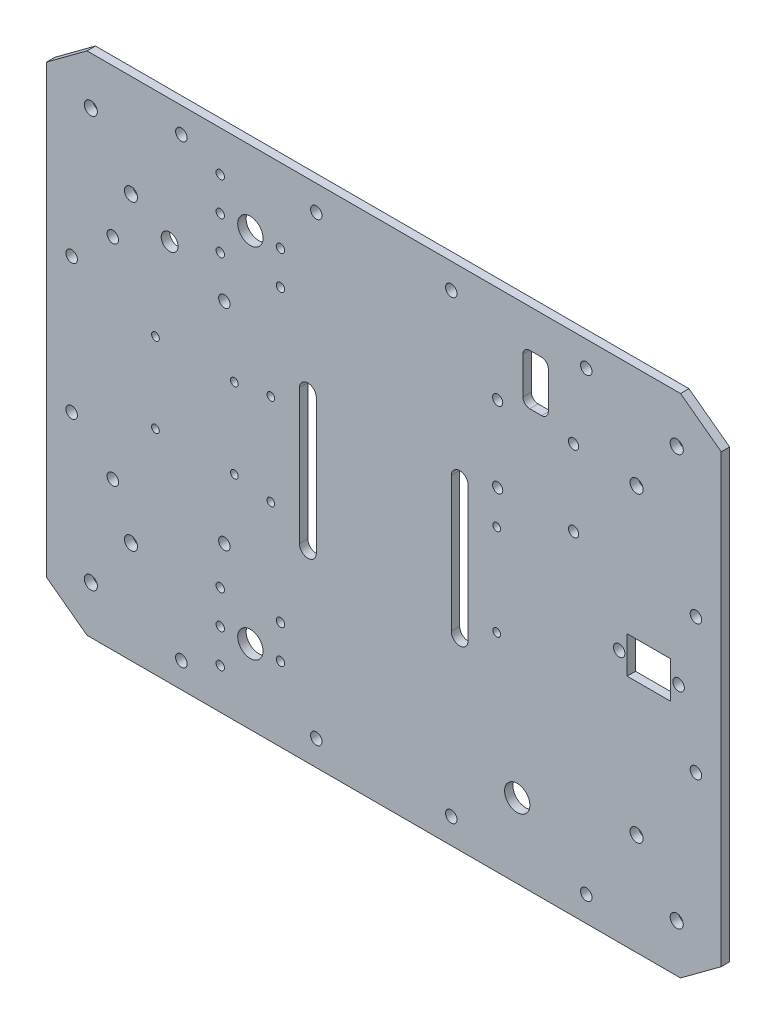
from build123d import *

# Parameters (mm, degrees)
SKETCH1_R                = 2.4638
BOSS_EXTRUDE1_DEPTH      = 3.175
SKETCH2_W                = 16.383
SKETCH2_H                = 13.843
SKETCH2_R                = 2.159
CUT_EXTRUDE1_DEPTH       = 159.781746826
SKETCH5_R                = 3.175
SKETCH5_R_2              = 2.159
SKETCH5_R_3              = 1.4478
CUT_EXTRUDE2_DEPTH       = 159.781746826
SKETCH6_R                = 2.159
CUT_EXTRUDE3_DEPTH       = 159.781746826
SKETCH5_3_R              = 1.45415
CUT_EXTRUDE4_DEPTH       = 159.781746826
SKETCH5_4_R              = 1.5875
SKETCH5_4_R_2            = 4.7625
CUT_EXTRUDE5_DEPTH       = 159.781746826
SKETCH5_5_R              = 1.5875
CUT_EXTRUDE6_DEPTH       = 2.54
SKETCH5_6_R              = 1.5875
CUT_EXTRUDE7_DEPTH       = 159.781746826
CUT_EXTRUDE8_DEPTH       = 7.62
CUT_EXTRUDE8_DEPTH_BACK  = 2.54
SKETCH5_7_W              = 9.525
SKETCH5_7_H              = 19.05
SKETCH5_7_R              = 1.9177
SKETCH5_7_R_2            = 1.5875
SKETCH5_9_R              = 1.9177
CUT_EXTRUDE9_DEPTH       = 159.781746826
SKETCH5_13_R             = 1.5875
CUT_EXTRUDE14_DEPTH      = 159.781746826
CUT_EXTRUDE17_DEPTH      = 159.781746826
CUT_EXTRUDE17_DEPTH_BACK = 159.781746826
SKETCH5_15_W             = 9.525
SKETCH5_15_H             = 19.05
FILLET1_R                = 2.54
FILLET2_R                = 2.54
FILLET3_R                = 2.54
FILLET4_R                = 2.54


with BuildPart() as part:
    # Sketch1 → Boss-Extrude1 (new body)
    with BuildSketch(Plane.XY):
        Polygon((-111.686526805, -95.25), (-127, -83.918625912), (-127, 83.918625912), (-111.686526805, 95.25), (111.686526805, 95.25), (127, 83.918625912), (127, -83.918625912), (111.686526805, -95.25), align=None)
        with Locations((-95.147512794, 56.885632681)):
            Circle(SKETCH1_R, mode=Mode.SUBTRACT)
        with Locations((-110.256011578, 77.303596941)):
            Circle(SKETCH1_R, mode=Mode.SUBTRACT)
        with Locations((110.256011578, 77.303596941)):
            Circle(SKETCH1_R, mode=Mode.SUBTRACT)
        with Locations((95.147512794, 56.885632681)):
            Circle(SKETCH1_R, mode=Mode.SUBTRACT)
        with Locations((-110.256011578, -77.303596941)):
            Circle(SKETCH1_R, mode=Mode.SUBTRACT)
        with Locations((-95.147512794, -56.885632681)):
            Circle(SKETCH1_R, mode=Mode.SUBTRACT)
        with Locations((110.256011578, -77.303596941)):
            Circle(SKETCH1_R, mode=Mode.SUBTRACT)
        with Locations((95.147512794, -56.885632681)):
            Circle(SKETCH1_R, mode=Mode.SUBTRACT)
    extrude(amount=BOSS_EXTRUDE1_DEPTH)

    # Sketch2 → Cut-Extrude1 (cut, through all)
    with BuildSketch(Plane.XY.offset(3.175)):
        with Locations((99.772576703, 0)):
            Rectangle(SKETCH2_W, SKETCH2_H)
        with Locations((110.948576703, 0)):
            Circle(SKETCH2_R)
        with Locations((88.596576703, 0)):
            Circle(SKETCH2_R)
    extrude(amount=-CUT_EXTRUDE1_DEPTH, mode=Mode.SUBTRACT)

    # Sketch5 → Cut-Extrude2 (cut, through all)
    with BuildSketch(Plane(origin=(0, 0, 0), x_dir=(-1, 0, 0), z_dir=(0, 0, -1))):
        with Locations((80.594630637, 48.58004)):
            Circle(SKETCH5_R)
        with Locations((59.995230637, -39.49954)):
            Circle(SKETCH5_R_2)
        with Locations((101.994130637, -39.49954)):
            Circle(SKETCH5_R_2)
        with Locations((101.994130637, 39.49954)):
            Circle(SKETCH5_R_2)
        with Locations((59.995230637, 39.49954)):
            Circle(SKETCH5_R_2)
        with BuildLine():
            Line((-31.75, 25.4), (-31.75, -25.4))
            ThreePointArc((-31.75, -25.4), (-28.575, -28.575), (-25.4, -25.4))
            Line((-25.4, -25.4), (-25.4, 25.4))
            ThreePointArc((-25.4, 25.4), (-28.575, 28.575), (-31.75, 25.4))
        make_face()
        with Locations((85.937708857, 15.03413)):
            Circle(SKETCH5_R_3)
        with Locations((56.219708857, 15.03413)):
            Circle(SKETCH5_R_3)
        with Locations((56.219708857, -15.03413)):
            Circle(SKETCH5_R_3)
        with Locations((85.937708857, -15.03413)):
            Circle(SKETCH5_R_3)
        with BuildLine():
            ThreePointArc((31.75, 25.4), (28.575, 28.575), (25.4, 25.4))
            Line((25.4, 25.4), (25.4, -25.4))
            ThreePointArc((25.4, -25.4), (28.575, -28.575), (31.75, -25.4))
            Line((31.75, -25.4), (31.75, 25.4))
        make_face()
    extrude(amount=-CUT_EXTRUDE2_DEPTH, mode=Mode.SUBTRACT)

    # Sketch6 → Cut-Extrude3 (cut, through all)
    with BuildSketch(Plane(origin=(0, 0, 0), x_dir=(-1, 0, 0), z_dir=(0, 0, -1))):
        with Locations((-76.2, -85.725)):
            Circle(SKETCH6_R)
        with Locations((-25.4, -85.725)):
            Circle(SKETCH6_R)
        with Locations((25.4, -85.725)):
            Circle(SKETCH6_R)
        with Locations((76.2, -85.725)):
            Circle(SKETCH6_R)
        with Locations((76.2, 85.725)):
            Circle(SKETCH6_R)
        with Locations((25.4, 85.725)):
            Circle(SKETCH6_R)
        with Locations((-25.4, 85.725)):
            Circle(SKETCH6_R)
        with Locations((-76.2, 85.725)):
            Circle(SKETCH6_R)
        with Locations((117.475, -25.4)):
            Circle(SKETCH6_R)
        with Locations((117.475, 25.4)):
            Circle(SKETCH6_R)
        with Locations((-117.475, 25.4)):
            Circle(SKETCH6_R)
        with Locations((-117.475, -25.4)):
            Circle(SKETCH6_R)
    extrude(amount=-CUT_EXTRUDE3_DEPTH, mode=Mode.SUBTRACT)

    # Sketch5<3> → Cut-Extrude4 (cut, through all)
    with BuildSketch(Plane(origin=(0, 0, 0), x_dir=(-1, 0, 0), z_dir=(0, 0, -1))):
        with Locations((-42.5, 17.2)):
            Circle(SKETCH5_3_R)
        with Locations((-42.5, -17.2)):
            Circle(SKETCH5_3_R)
        with Locations((42.5, -17.2)):
            Circle(SKETCH5_3_R)
        with Locations((42.5, 17.2)):
            Circle(SKETCH5_3_R)
    extrude(amount=-CUT_EXTRUDE4_DEPTH, mode=Mode.SUBTRACT)

    # Sketch5<4> → Cut-Extrude5 (cut, through all)
    with BuildSketch(Plane(origin=(0, 0, 0), x_dir=(-1, 0, 0), z_dir=(0, 0, -1))):
        with Locations((61.544630637, -54.61)):
            Circle(SKETCH5_4_R)
        with Locations((61.544630637, -67.31)):
            Circle(SKETCH5_4_R)
        with Locations((61.544630637, 54.61)):
            Circle(SKETCH5_4_R)
        with Locations((61.544630637, -80.01)):
            Circle(SKETCH5_4_R)
        with Locations((-50.215369363, -67.31)):
            Circle(SKETCH5_4_R_2)
        with Locations((50.215369363, -67.31)):
            Circle(SKETCH5_4_R_2)
        with Locations((61.544630637, 67.31)):
            Circle(SKETCH5_4_R)
        with Locations((61.544630637, 80.01)):
            Circle(SKETCH5_4_R)
        with Locations((50.215369363, 67.31)):
            Circle(SKETCH5_4_R_2)
    extrude(amount=-CUT_EXTRUDE5_DEPTH, mode=Mode.SUBTRACT)

    # Sketch5<5> → Cut-Extrude6 (cut)
    with BuildSketch(Plane(origin=(0, 0, 0), x_dir=(-1, 0, 0), z_dir=(0, 0, -1))):
        with Locations((38.886108088, 67.31)):
            Circle(SKETCH5_5_R)
        with Locations((38.886108088, 54.61)):
            Circle(SKETCH5_5_R)
        with Locations((38.886108088, -67.31)):
            Circle(SKETCH5_5_R)
    extrude(amount=-CUT_EXTRUDE6_DEPTH, mode=Mode.SUBTRACT)

    # Sketch5<6> → Cut-Extrude7 (cut, through all)
    with BuildSketch(Plane(origin=(0, 0, 0), x_dir=(-1, 0, 0), z_dir=(0, 0, -1))):
        with Locations((38.886108088, 67.31)):
            Circle(SKETCH5_6_R)
        with Locations((38.886108088, 54.61)):
            Circle(SKETCH5_6_R)
        with Locations((38.886108088, -67.31)):
            Circle(SKETCH5_6_R)
    extrude(amount=-CUT_EXTRUDE7_DEPTH, mode=Mode.SUBTRACT)

    # Sketch5<7> → Cut-Extrude8 (cut, two sides: drawn at the far end of the back side and taken through both)
    with BuildSketch(Plane(origin=(0, 0, 0), x_dir=(-1, 0, 0), z_dir=(0, 0, -1)).offset(-CUT_EXTRUDE8_DEPTH_BACK)):
        with Locations((-57.15, 71.4375)):
            Rectangle(SKETCH5_7_W, SKETCH5_7_H)
        with Locations((-71.4375, 58.7375)):
            Circle(SKETCH5_7_R)
        with Locations((-71.4375, 30.1625)):
            Circle(SKETCH5_7_R)
        with Locations((38.886108088, -54.61)):
            Circle(SKETCH5_7_R_2)
        with Locations((-42.8625, 58.7375)):
            Circle(SKETCH5_7_R)
        with Locations((-42.8625, 30.1625)):
            Circle(SKETCH5_7_R)
    extrude(amount=CUT_EXTRUDE8_DEPTH + CUT_EXTRUDE8_DEPTH_BACK, mode=Mode.SUBTRACT)

    # Sketch5<9> → Cut-Extrude9 (cut, through all)
    with BuildSketch(Plane(origin=(0, 0, 0), x_dir=(-1, 0, 0), z_dir=(0, 0, -1))):
        with Locations((-71.4375, 58.7375)):
            Circle(SKETCH5_9_R)
        with Locations((-71.4375, 30.1625)):
            Circle(SKETCH5_9_R)
        with Locations((-42.8625, 58.7375)):
            Circle(SKETCH5_9_R)
        with Locations((-42.8625, 30.1625)):
            Circle(SKETCH5_9_R)
    extrude(amount=-CUT_EXTRUDE9_DEPTH, mode=Mode.SUBTRACT)

    # Sketch5<13> → Cut-Extrude14 (cut, through all)
    with BuildSketch(Plane(origin=(0, 0, 0), x_dir=(-1, 0, 0), z_dir=(0, 0, -1))):
        with Locations((38.886108088, -54.61)):
            Circle(SKETCH5_13_R)
    extrude(amount=-CUT_EXTRUDE14_DEPTH, mode=Mode.SUBTRACT)

    # Sketch5<15> → Cut-Extrude17 (cut, two sides: drawn at the far end of the back side and taken through both)
    with BuildSketch(Plane(origin=(0, 0, 0), x_dir=(-1, 0, 0), z_dir=(0, 0, -1)).offset(-CUT_EXTRUDE17_DEPTH_BACK)):
        with Locations((-57.15, 71.4375)):
            Rectangle(SKETCH5_15_W, SKETCH5_15_H)
    extrude(amount=CUT_EXTRUDE17_DEPTH + CUT_EXTRUDE17_DEPTH_BACK, mode=Mode.SUBTRACT)

    # Fillet1
    fillet1_edges = [part.edges().sort_by_distance(p)[0] for p in [
        (61.9125, 80.9625, 1.5875),
    ]]
    fillet(fillet1_edges, radius=FILLET1_R)

    # Fillet2
    fillet2_edges = [part.edges().sort_by_distance(p)[0] for p in [
        (52.3875, 80.9625, 1.5875),
    ]]
    fillet(fillet2_edges, radius=FILLET2_R)

    # Fillet3
    fillet3_edges = [part.edges().sort_by_distance(p)[0] for p in [
        (52.3875, 61.9125, 1.5875),
    ]]
    fillet(fillet3_edges, radius=FILLET3_R)

    # Fillet4
    fillet4_edges = [part.edges().sort_by_distance(p)[0] for p in [
        (61.9125, 61.9125, 1.5875),
    ]]
    fillet(fillet4_edges, radius=FILLET4_R)


solid = part.part
